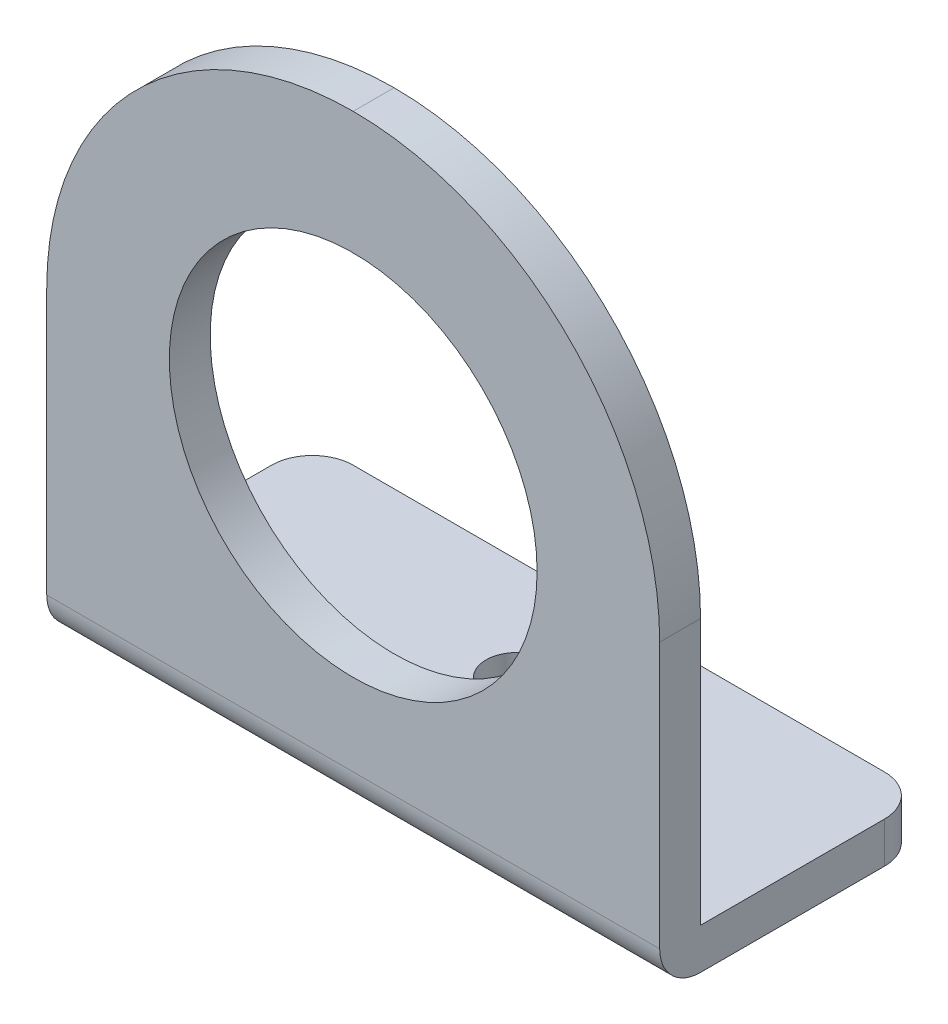
from build123d import *

# Parameters (mm, degrees)
SKETCH1_W           = 30
SKETCH1_H           = 30
BOSS_EXTRUDE1_DEPTH = 2
SKETCH2_R           = 9
CUT_EXTRUDE1_DEPTH  = 22.307275753
FILLET1_R           = 15
SKETCH3_W           = 30
SKETCH3_H           = 2
BOSS_EXTRUDE2_DEPTH = 11
SKETCH4_R           = 1.5
CUT_EXTRUDE2_DEPTH  = 34.615472628
FILLET2_R           = 2


with BuildPart() as part:
    # Sketch1 → Boss-Extrude1 (new body)
    with BuildSketch(Plane.XY):
        Rectangle(SKETCH1_W, SKETCH1_H)
    extrude(amount=BOSS_EXTRUDE1_DEPTH)

    # Sketch2 → Cut-Extrude1 (cut, through all)
    with BuildSketch(Plane.XY.offset(2)):
        Circle(SKETCH2_R)
    extrude(amount=-CUT_EXTRUDE1_DEPTH, mode=Mode.SUBTRACT)

    # Fillet1
    fillet1_edges = [part.edges().sort_by_distance(p)[0] for p in [
        (-15, 15, 1),
        (15, 15, 1),
    ]]
    fillet(fillet1_edges, radius=FILLET1_R - 0.0001)  # a hair under: the kernel refuses the full size

    # Sketch3 → Boss-Extrude2 (add)
    with BuildSketch(Plane(origin=(0, 0, 0), x_dir=(-1, 0, 0), z_dir=(0, 0, -1))):
        with Locations((0, -14)):
            Rectangle(SKETCH3_W, SKETCH3_H)
    extrude(amount=BOSS_EXTRUDE2_DEPTH)

    # Sketch4 → Cut-Extrude2 (cut, through all)
    with BuildSketch(Plane(origin=(0, -13, 0), x_dir=(1, 0, 0), z_dir=(0, 1, 0))):
        with Locations(Location((0, 6, 0), (0, 0, 270))):
            Circle(SKETCH4_R)
    extrude(amount=-CUT_EXTRUDE2_DEPTH, mode=Mode.SUBTRACT)

    # Fillet2
    fillet2_edges = [part.edges().sort_by_distance(p)[0] for p in [
        (15, -14, -11),
        (-15, -14, -11),
        (0, -15, 2),
    ]]
    fillet(fillet2_edges, radius=FILLET2_R)


solid = part.part
